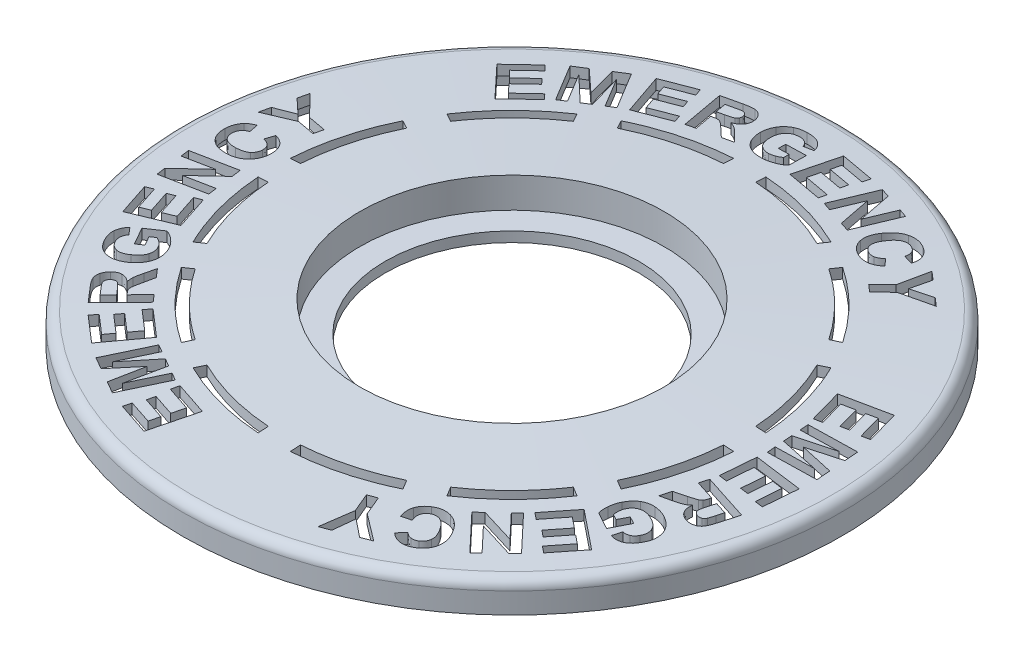
from build123d import *

# Parameters (mm, degrees)
SKETCH1_R           = 32.5
SKETCH1_R_2         = 12.5
BOSS_EXTRUDE1_DEPTH = 4
SKETCH2_R           = 15
CUT_EXTRUDE1_DEPTH  = 3
FILLET1_R           = 1
CUT_EXTRUDE5_DEPTH  = 4


# Read off the part's stored shape, not the designer's step: Shell2
with BuildPart() as part:
    # Sketch1 → Boss-Extrude1 (new body)
    with BuildSketch(Plane(origin=(0, 0, 0), x_dir=(1, 0, 0), z_dir=(0, 1, 0))):
        with Locations(Location((0, 0, 0), (0, 0, 270))):
            Circle(SKETCH1_R)
        with Locations(Location((0, 0, 0), (0, 0, 270))):
            Circle(SKETCH1_R_2, mode=Mode.SUBTRACT)
    extrude(amount=BOSS_EXTRUDE1_DEPTH)

    # Sketch2 → Cut-Extrude1 (cut)
    with BuildSketch(Plane(origin=(0, 4, 0), x_dir=(1, 0, 0), z_dir=(0, 1, 0))):
        with Locations(Location((0, 0, 0), (0, 0, 270))):
            Circle(SKETCH2_R)
    extrude(amount=-CUT_EXTRUDE1_DEPTH, mode=Mode.SUBTRACT)

    # Sketch4 → Cut-Revolve1 (revolve, cut)
    with BuildSketch(Plane.XY, mode=Mode.PRIVATE) as cut_revolve1_sk:
        Polygon((-15, 4), (-32.5, 3), (-34.981783944, 3), (-34.981783944, 6.837643027), (-15, 6.837643027), align=None)
    revolve(cut_revolve1_sk.sketch.rotate(Axis((0, 4, 0), (0, -1, 0)), 270), axis=Axis((0, 4, 0), (0, -1, 0)), mode=Mode.SUBTRACT)

    # Fillet1
    fillet1_edges = [part.edges().sort_by_distance(p)[0] for p in [
        (0, 3, -32.5),
    ]]
    fillet(fillet1_edges, radius=FILLET1_R)

    # Shell2 outline → Shell2 (revolve, cut)
    with BuildSketch(Plane.XY):
        Polygon((31.5, 0), (31.5, 2.055511535), (16, 2.94122582), (16, 0), align=None)
    revolve(axis=Axis((0, 0, 0), (0, 1, 0)), mode=Mode.SUBTRACT)

    # Sketch6 → Cut-Extrude5 (cut)
    # profile 1 of 39: a face of its own
    with BuildSketch(Plane(origin=(0, 0, 0), x_dir=(1, 0, 0), z_dir=(0, 1, 0))):
        with BuildLine():
            Line((-19.5123, 13.0985), (-18.6438, 12.5971))
            add(Edge.make_bspline(
                [(-18.6438, 12.5971), (-17.0322, 14.977), (-14.9772, 17.0323), (-12.5969, 18.6435)],
                knots=[0.4, 0.4, 0.4, 0.4, 0.6, 0.6, 0.6, 0.6], degree=3))
            Line((-12.5969, 18.6435), (-13.0981, 19.5115))
            add(Edge.make_bspline(
                [(-13.0981, 19.5115), (-15.6288, 17.8098), (-17.81, 15.6286), (-19.5123, 13.0985)],
                knots=[0, 0, 0, 0, 0.2, 0.2, 0.2, 0.2], degree=3))
        make_face()
    # profile 2 of 39: a face of its own
    with BuildSketch(Plane(origin=(0, 0, 0), x_dir=(1, 0, 0), z_dir=(0, 1, 0))):
        with BuildLine():
            Line((-23.4471, 1.5875), (-22.4447, 1.5875))
            add(Edge.make_bspline(
                [(-22.4447, 1.5875), (-22.2393, 4.5341), (-21.4664, 7.3242), (-20.2345, 9.8493)],
                knots=[0.4, 0.4, 0.4, 0.4, 0.6, 0.6, 0.6, 0.6], degree=3))
            Line((-20.2345, 9.8493), (-21.1026, 10.3504))
            add(Edge.make_bspline(
                [(-21.1026, 10.3504), (-22.4171, 7.6763), (-23.2383, 4.7158), (-23.4471, 1.5875)],
                knots=[0, 0, 0, 0, 0.2, 0.2, 0.2, 0.2], degree=3))
        make_face()
    # profile 3 of 39: a face of its own
    with BuildSketch(Plane(origin=(0, 0, 0), x_dir=(1, 0, 0), z_dir=(0, 1, 0))):
        with BuildLine():
            Line((1.5875, 23.4455), (1.5875, 22.4435))
            add(Edge.make_bspline(
                [(1.5875, 22.4435), (4.5339, 22.2381), (7.3237, 21.465), (9.8487, 20.2334)],
                knots=[0.4, 0.4, 0.4, 0.4, 0.6, 0.6, 0.6, 0.6], degree=3))
            Line((9.8487, 20.2334), (10.3498, 21.1015))
            add(Edge.make_bspline(
                [(10.3498, 21.1015), (7.6758, 22.4158), (4.7155, 23.2368), (1.5875, 23.4455)],
                knots=[0, 0, 0, 0, 0.2, 0.2, 0.2, 0.2], degree=3))
        make_face()
    # profile 4 of 39: a face of its own
    with BuildSketch(Plane(origin=(0, 0, 0), x_dir=(1, 0, 0), z_dir=(0, 1, 0))):
        with BuildLine():
            Line((13.0979, 19.5112), (12.5969, 18.6434))
            add(Edge.make_bspline(
                [(12.5969, 18.6434), (14.9769, 17.032), (17.0322, 14.9771), (18.6436, 12.597)],
                knots=[0.4, 0.4, 0.4, 0.4, 0.6, 0.6, 0.6, 0.6], degree=3))
            Line((18.6436, 12.597), (19.5115, 13.0981))
            add(Edge.make_bspline(
                [(19.5115, 13.0981), (17.8096, 15.6284), (15.6281, 17.8092), (13.0979, 19.5112)],
                knots=[0, 0, 0, 0, 0.2, 0.2, 0.2, 0.2], degree=3))
        make_face()
    # profile 5 of 39: a face of its own
    with BuildSketch(Plane(origin=(0, 0, 0), x_dir=(1, 0, 0), z_dir=(0, 1, 0))):
        with BuildLine():
            Line((21.1018, 10.35), (20.2341, 9.849))
            add(Edge.make_bspline(
                [(20.2341, 9.849), (21.4656, 7.3238), (22.2387, 4.534), (22.4441, 1.5875)],
                knots=[0.4, 0.4, 0.4, 0.4, 0.6, 0.6, 0.6, 0.6], degree=3))
            Line((22.4441, 1.5875), (23.4459, 1.5875))
            add(Edge.make_bspline(
                [(23.4459, 1.5875), (23.2372, 4.7156), (22.416, 7.6758), (21.1018, 10.35)],
                knots=[0, 0, 0, 0, 0.2, 0.2, 0.2, 0.2], degree=3))
        make_face()
    # profile 6 of 39: a face of its own
    with BuildSketch(Plane(origin=(0, 0, 0), x_dir=(1, 0, 0), z_dir=(0, 1, 0))):
        with BuildLine():
            Line((23.4471, -1.5875), (22.4447, -1.5875))
            add(Edge.make_bspline(
                [(22.4447, -1.5875), (22.2393, -4.5341), (21.4664, -7.3242), (20.2345, -9.8493)],
                knots=[0.4, 0.4, 0.4, 0.4, 0.6, 0.6, 0.6, 0.6], degree=3))
            Line((20.2345, -9.8493), (21.1026, -10.3504))
            add(Edge.make_bspline(
                [(21.1026, -10.3504), (22.4171, -7.6763), (23.2383, -4.7158), (23.4471, -1.5875)],
                knots=[0, 0, 0, 0, 0.2, 0.2, 0.2, 0.2], degree=3))
        make_face()
    # profile 7 of 39: a face of its own
    with BuildSketch(Plane(origin=(0, 0, 0), x_dir=(1, 0, 0), z_dir=(0, 1, 0))):
        with BuildLine():
            Line((19.5123, -13.0985), (18.6438, -12.5971))
            add(Edge.make_bspline(
                [(18.6438, -12.5971), (17.0322, -14.977), (14.9772, -17.0323), (12.5969, -18.6435)],
                knots=[0.4, 0.4, 0.4, 0.4, 0.6, 0.6, 0.6, 0.6], degree=3))
            Line((12.5969, -18.6435), (13.0981, -19.5115))
            add(Edge.make_bspline(
                [(13.0981, -19.5115), (15.6288, -17.8098), (17.81, -15.6286), (19.5123, -13.0985)],
                knots=[0, 0, 0, 0, 0.2, 0.2, 0.2, 0.2], degree=3))
        make_face()
    # profile 8 of 39: a face of its own
    with BuildSketch(Plane(origin=(0, 0, 0), x_dir=(1, 0, 0), z_dir=(0, 1, 0))):
        with BuildLine():
            Line((10.3495, -21.1009), (9.8488, -20.2336))
            add(Edge.make_bspline(
                [(9.8488, -20.2336), (7.3236, -21.4649), (4.5338, -22.2381), (1.5875, -22.4435)],
                knots=[0.4, 0.4, 0.4, 0.4, 0.6, 0.6, 0.6, 0.6], degree=3))
            Line((1.5875, -22.4435), (1.5875, -23.4455))
            add(Edge.make_bspline(
                [(1.5875, -23.4455), (4.7155, -23.2368), (7.6753, -22.4148), (10.3495, -21.1009)],
                knots=[0, 0, 0, 0, 0.2, 0.2, 0.2, 0.2], degree=3))
        make_face()
    # profile 9 of 39: a face of its own
    with BuildSketch(Plane(origin=(0, 0, 0), x_dir=(1, 0, 0), z_dir=(0, 1, 0))):
        with BuildLine():
            Line((-1.5875, -23.4471), (-1.5875, -22.4447))
            add(Edge.make_bspline(
                [(-1.5875, -22.4447), (-4.5341, -22.2393), (-7.3242, -21.4664), (-9.8493, -20.2345)],
                knots=[0.4, 0.4, 0.4, 0.4, 0.6, 0.6, 0.6, 0.6], degree=3))
            Line((-9.8493, -20.2345), (-10.3504, -21.1026))
            add(Edge.make_bspline(
                [(-10.3504, -21.1026), (-7.6763, -22.4171), (-4.7158, -23.2383), (-1.5875, -23.4471)],
                knots=[0, 0, 0, 0, 0.2, 0.2, 0.2, 0.2], degree=3))
        make_face()
    # profile 10 of 39: a face of its own
    with BuildSketch(Plane(origin=(0, 0, 0), x_dir=(1, 0, 0), z_dir=(0, 1, 0))):
        with BuildLine():
            Line((-13.0985, -19.5123), (-12.5971, -18.6438))
            add(Edge.make_bspline(
                [(-12.5971, -18.6438), (-14.977, -17.0322), (-17.0323, -14.9772), (-18.6435, -12.5969)],
                knots=[0.4, 0.4, 0.4, 0.4, 0.6, 0.6, 0.6, 0.6], degree=3))
            Line((-18.6435, -12.5969), (-19.5115, -13.0981))
            add(Edge.make_bspline(
                [(-19.5115, -13.0981), (-17.8098, -15.6288), (-15.6286, -17.81), (-13.0985, -19.5123)],
                knots=[0, 0, 0, 0, 0.2, 0.2, 0.2, 0.2], degree=3))
        make_face()
    # profile 11 of 39: a face of its own
    with BuildSketch(Plane(origin=(0, 0, 0), x_dir=(1, 0, 0), z_dir=(0, 1, 0))):
        with BuildLine():
            Line((-21.1009, -10.3495), (-20.2336, -9.8488))
            add(Edge.make_bspline(
                [(-20.2336, -9.8488), (-21.4649, -7.3236), (-22.2381, -4.5338), (-22.4435, -1.5875)],
                knots=[0.4, 0.4, 0.4, 0.4, 0.6, 0.6, 0.6, 0.6], degree=3))
            Line((-22.4435, -1.5875), (-23.4455, -1.5875))
            add(Edge.make_bspline(
                [(-23.4455, -1.5875), (-23.2368, -4.7155), (-22.4148, -7.6753), (-21.1009, -10.3495)],
                knots=[0, 0, 0, 0, 0.2, 0.2, 0.2, 0.2], degree=3))
        make_face()
    # profile 12 of 39: a face of its own
    with BuildSketch(Plane(origin=(0, 0, 0), x_dir=(1, 0, 0), z_dir=(0, 1, 0))):
        with BuildLine():
            add(Edge.make_bspline(
                [(-25.87, 1.7114), (-26.0189, 1.8914), (-26.2581, 2.0255), (-26.5875, 2.1138)],
                knots=[0.894736842, 0.894736842, 0.894736842, 0.894736842, 1, 1, 1, 1], degree=3))
            Line((-26.5875, 2.1138), (-26.2759, 2.9931))
            add(Edge.make_bspline(
                [(-26.2759, 2.9931), (-25.7849, 2.84), (-25.4249, 2.6), (-25.1946, 2.2755)],
                knots=[0.052631579, 0.052631579, 0.052631579, 0.052631579, 0.105263158, 0.105263158, 0.105263158, 0.105263158], degree=3))
            add(Edge.make_bspline(
                [(-25.1946, 2.2755), (-24.9653, 1.9509), (-24.8585, 1.5447), (-24.8749, 1.057)],
                knots=[0.105263158, 0.105263158, 0.105263158, 0.105263158, 0.157894737, 0.157894737, 0.157894737, 0.157894737], degree=3))
            add(Edge.make_bspline(
                [(-24.8749, 1.057), (-24.8955, 0.4538), (-25.1184, -0.0344), (-25.5436, -0.4079)],
                knots=[0.157894737, 0.157894737, 0.157894737, 0.157894737, 0.210526316, 0.210526316, 0.210526316, 0.210526316], degree=3))
            add(Edge.make_bspline(
                [(-25.5436, -0.4079), (-25.9688, -0.7824), (-26.5385, -0.9579), (-27.2527, -0.9333)],
                knots=[0.210526316, 0.210526316, 0.210526316, 0.210526316, 0.263157895, 0.263157895, 0.263157895, 0.263157895], degree=3))
            add(Edge.make_bspline(
                [(-27.2527, -0.9333), (-28.0082, -0.9073), (-28.5886, -0.6921), (-28.993, -0.2879)],
                knots=[0.263157895, 0.263157895, 0.263157895, 0.263157895, 0.315789474, 0.315789474, 0.315789474, 0.315789474], degree=3))
            add(Edge.make_bspline(
                [(-28.993, -0.2879), (-29.3983, 0.1164), (-29.59, 0.6365), (-29.5681, 1.2725)],
                knots=[0.315789474, 0.315789474, 0.315789474, 0.315789474, 0.368421053, 0.368421053, 0.368421053, 0.368421053], degree=3))
            add(Edge.make_bspline(
                [(-29.5681, 1.2725), (-29.549, 1.8279), (-29.3698, 2.2732), (-29.0296, 2.6092)],
                knots=[0.368421053, 0.368421053, 0.368421053, 0.368421053, 0.421052632, 0.421052632, 0.421052632, 0.421052632], degree=3))
            add(Edge.make_bspline(
                [(-29.0296, 2.6092), (-28.828, 2.8087), (-28.5443, 2.9535), (-28.1774, 3.0449)],
                knots=[0.421052632, 0.421052632, 0.421052632, 0.421052632, 0.473684211, 0.473684211, 0.473684211, 0.473684211], degree=3))
            Line((-28.1774, 3.0449), (-27.9919, 2.1301))
            add(Edge.make_bspline(
                [(-27.9919, 2.1301), (-28.2293, 2.0843), (-28.4185, 1.9789), (-28.5606, 1.8128)],
                knots=[0.526315789, 0.526315789, 0.526315789, 0.526315789, 0.578947368, 0.578947368, 0.578947368, 0.578947368], degree=3))
            add(Edge.make_bspline(
                [(-28.5606, 1.8128), (-28.7027, 1.6477), (-28.7773, 1.443), (-28.7866, 1.1997)],
                knots=[0.578947368, 0.578947368, 0.578947368, 0.578947368, 0.631578947, 0.631578947, 0.631578947, 0.631578947], degree=3))
            add(Edge.make_bspline(
                [(-28.7866, 1.1997), (-28.7977, 0.8621), (-28.6855, 0.585), (-28.4512, 0.3673)],
                knots=[0.631578947, 0.631578947, 0.631578947, 0.631578947, 0.684210526, 0.684210526, 0.684210526, 0.684210526], degree=3))
            add(Edge.make_bspline(
                [(-28.4512, 0.3673), (-28.2169, 0.1496), (-27.8294, 0.0322), (-27.2887, 0.0132)],
                knots=[0.684210526, 0.684210526, 0.684210526, 0.684210526, 0.736842105, 0.736842105, 0.736842105, 0.736842105], degree=3))
            add(Edge.make_bspline(
                [(-27.2887, 0.0132), (-26.7142, -0.0061), (-26.3028, 0.0838), (-26.0515, 0.2818)],
                knots=[0.736842105, 0.736842105, 0.736842105, 0.736842105, 0.789473684, 0.789473684, 0.789473684, 0.789473684], degree=3))
            add(Edge.make_bspline(
                [(-26.0515, 0.2818), (-25.8013, 0.48), (-25.6701, 0.7435), (-25.659, 1.0747)],
                knots=[0.789473684, 0.789473684, 0.789473684, 0.789473684, 0.842105263, 0.842105263, 0.842105263, 0.842105263], degree=3))
            add(Edge.make_bspline(
                [(-25.659, 1.0747), (-25.6507, 1.318), (-25.7211, 1.5303), (-25.87, 1.7114)],
                knots=[0.842105263, 0.842105263, 0.842105263, 0.842105263, 0.894736842, 0.894736842, 0.894736842, 0.894736842], degree=3))
        make_face()
    # profile 13 of 39: a face of its own
    with BuildSketch(Plane(origin=(0, 0, 0), x_dir=(1, 0, 0), z_dir=(0, 1, 0))):
        Polygon((-24.2764, -6.1642), (-23.1924, -9.4445), (-27.5043, -10.8702), (-28.5613, -7.6726), (-27.8319, -7.431), (-27.0633, -9.7581), (-26.1071, -9.4415), (-26.8225, -7.2766), (-26.0962, -7.037), (-25.3808, -9.2021), (-24.2071, -8.8136), (-25.0038, -6.4047), align=None)
    # profile 14 of 39: a face of its own
    with BuildSketch(Plane(origin=(0, 0, 0), x_dir=(1, 0, 0), z_dir=(0, 1, 0))):
        with BuildLine():
            add(Edge.make_bspline(
                [(-22.922, -11.9042), (-23.0838, -11.7738), (-23.2455, -11.6751), (-23.4073, -11.6081)],
                knots=[0.84, 0.84, 0.84, 0.84, 0.88, 0.88, 0.88, 0.88], degree=3))
            Line((-23.4073, -11.6081), (-23.9074, -11.893))
            Line((-23.9074, -11.893), (-23.3872, -12.8052))
            Line((-23.3872, -12.8052), (-24.0515, -13.1849))
            Line((-24.0515, -13.1849), (-25.0316, -11.4676))
            Line((-25.0316, -11.4676), (-23.4594, -10.5719))
            add(Edge.make_bspline(
                [(-23.4594, -10.5719), (-23.2034, -10.6465), (-22.9233, -10.8068), (-22.6189, -11.0529)],
                knots=[0.12, 0.12, 0.12, 0.12, 0.16, 0.16, 0.16, 0.16], degree=3))
            add(Edge.make_bspline(
                [(-22.6189, -11.0529), (-22.3156, -11.3001), (-22.0716, -11.5851), (-21.886, -11.9105)],
                knots=[0.16, 0.16, 0.16, 0.16, 0.2, 0.2, 0.2, 0.2], degree=3))
            add(Edge.make_bspline(
                [(-21.886, -11.9105), (-21.6507, -12.3225), (-21.5329, -12.7324), (-21.5305, -13.1377)],
                knots=[0.2, 0.2, 0.2, 0.2, 0.24, 0.24, 0.24, 0.24], degree=3))
            add(Edge.make_bspline(
                [(-21.5305, -13.1377), (-21.529, -13.543), (-21.6451, -13.9143), (-21.8785, -14.2525)],
                knots=[0.24, 0.24, 0.24, 0.24, 0.28, 0.28, 0.28, 0.28], degree=3))
            add(Edge.make_bspline(
                [(-21.8785, -14.2525), (-22.1131, -14.5907), (-22.4194, -14.8674), (-22.7976, -15.0837)],
                knots=[0.28, 0.28, 0.28, 0.28, 0.32, 0.32, 0.32, 0.32], degree=3))
            add(Edge.make_bspline(
                [(-22.7976, -15.0837), (-23.2087, -15.318), (-23.6227, -15.44), (-24.0408, -15.4498)],
                knots=[0.32, 0.32, 0.32, 0.32, 0.36, 0.36, 0.36, 0.36], degree=3))
            add(Edge.make_bspline(
                [(-24.0408, -15.4498), (-24.4578, -15.4596), (-24.846, -15.3468), (-25.2065, -15.1122)],
                knots=[0.36, 0.36, 0.36, 0.36, 0.4, 0.4, 0.4, 0.4], degree=3))
            add(Edge.make_bspline(
                [(-25.2065, -15.1122), (-25.4813, -14.9339), (-25.7263, -14.6572), (-25.9415, -14.2801)],
                knots=[0.4, 0.4, 0.4, 0.4, 0.44, 0.44, 0.44, 0.44], degree=3))
            add(Edge.make_bspline(
                [(-25.9415, -14.2801), (-26.2211, -13.7906), (-26.3357, -13.3491), (-26.2873, -12.9565)],
                knots=[0.44, 0.44, 0.44, 0.44, 0.48, 0.48, 0.48, 0.48], degree=3))
            add(Edge.make_bspline(
                [(-26.2873, -12.9565), (-26.239, -12.564), (-26.0563, -12.2246), (-25.7394, -11.9394)],
                knots=[0.48, 0.48, 0.48, 0.48, 0.52, 0.52, 0.52, 0.52], degree=3))
            Line((-25.7394, -11.9394), (-25.1396, -12.6464))
            add(Edge.make_bspline(
                [(-25.1396, -12.6464), (-25.3018, -12.8123), (-25.3952, -13.0037), (-25.42, -13.2216)],
                knots=[0.56, 0.56, 0.56, 0.56, 0.6, 0.6, 0.6, 0.6], degree=3))
            add(Edge.make_bspline(
                [(-25.42, -13.2216), (-25.4447, -13.4385), (-25.3912, -13.6619), (-25.2603, -13.8918)],
                knots=[0.6, 0.6, 0.6, 0.6, 0.64, 0.64, 0.64, 0.64], degree=3))
            add(Edge.make_bspline(
                [(-25.2603, -13.8918), (-25.062, -14.2393), (-24.7936, -14.4536), (-24.4561, -14.5336)],
                knots=[0.64, 0.64, 0.64, 0.64, 0.68, 0.68, 0.68, 0.68], degree=3))
            add(Edge.make_bspline(
                [(-24.4561, -14.5336), (-24.1186, -14.6126), (-23.7322, -14.5286), (-23.2978, -14.2807)],
                knots=[0.68, 0.68, 0.68, 0.68, 0.72, 0.72, 0.72, 0.72], degree=3))
            add(Edge.make_bspline(
                [(-23.2978, -14.2807), (-22.8296, -14.0138), (-22.538, -13.7094), (-22.423, -13.3678)],
                knots=[0.72, 0.72, 0.72, 0.72, 0.76, 0.76, 0.76, 0.76], degree=3))
            add(Edge.make_bspline(
                [(-22.423, -13.3678), (-22.3071, -13.0262), (-22.3456, -12.6875), (-22.5376, -12.3495)],
                knots=[0.76, 0.76, 0.76, 0.76, 0.8, 0.8, 0.8, 0.8], degree=3))
            add(Edge.make_bspline(
                [(-22.5376, -12.3495), (-22.6336, -12.1831), (-22.7614, -12.0347), (-22.922, -11.9042)],
                knots=[0.8, 0.8, 0.8, 0.8, 0.84, 0.84, 0.84, 0.84], degree=3))
        make_face()
    # profile 15 of 39: a face of its own
    with BuildSketch(Plane(origin=(0, 0, 0), x_dir=(1, 0, 0), z_dir=(0, 1, 0))):
        with BuildLine():
            add(Edge.make_bspline(
                [(-20.4281, -17.4009), (-20.3901, -17.4962), (-20.3025, -17.6243), (-20.1652, -17.7834)],
                knots=[0.736842105, 0.736842105, 0.736842105, 0.736842105, 0.789473684, 0.789473684, 0.789473684, 0.789473684], degree=3))
            Line((-20.1652, -17.7834), (-20.0438, -17.9244))
            Line((-20.0438, -17.9244), (-18.6097, -16.6854))
            Line((-18.6097, -16.6854), (-18.0098, -17.3796))
            Line((-18.0098, -17.3796), (-21.447, -20.3466))
            Line((-21.447, -20.3466), (-22.7082, -18.886))
            add(Edge.make_bspline(
                [(-22.7082, -18.886), (-23.0251, -18.5182), (-23.2245, -18.2248), (-23.3067, -18.0056)],
                knots=[0.105263158, 0.105263158, 0.105263158, 0.105263158, 0.157894737, 0.157894737, 0.157894737, 0.157894737], degree=3))
            add(Edge.make_bspline(
                [(-23.3067, -18.0056), (-23.3878, -17.7853), (-23.3938, -17.5577), (-23.3224, -17.3218)],
                knots=[0.157894737, 0.157894737, 0.157894737, 0.157894737, 0.210526316, 0.210526316, 0.210526316, 0.210526316], degree=3))
            add(Edge.make_bspline(
                [(-23.3224, -17.3218), (-23.2501, -17.0849), (-23.1133, -16.8788), (-22.9097, -16.7034)],
                knots=[0.210526316, 0.210526316, 0.210526316, 0.210526316, 0.263157895, 0.263157895, 0.263157895, 0.263157895], degree=3))
            add(Edge.make_bspline(
                [(-22.9097, -16.7034), (-22.6521, -16.4816), (-22.3737, -16.3731), (-22.0752, -16.3799)],
                knots=[0.263157895, 0.263157895, 0.263157895, 0.263157895, 0.315789474, 0.315789474, 0.315789474, 0.315789474], degree=3))
            add(Edge.make_bspline(
                [(-22.0752, -16.3799), (-21.7757, -16.3868), (-21.4743, -16.5216), (-21.17, -16.7858)],
                knots=[0.315789474, 0.315789474, 0.315789474, 0.315789474, 0.368421053, 0.368421053, 0.368421053, 0.368421053], degree=3))
            add(Edge.make_bspline(
                [(-21.17, -16.7858), (-21.2119, -16.5602), (-21.2232, -16.3528), (-21.2028, -16.1645)],
                knots=[0.368421053, 0.368421053, 0.368421053, 0.368421053, 0.421052632, 0.421052632, 0.421052632, 0.421052632], degree=3))
            add(Edge.make_bspline(
                [(-21.2028, -16.1645), (-21.1823, -15.9771), (-21.1099, -15.6852), (-20.9853, -15.2885)],
                knots=[0.421052632, 0.421052632, 0.421052632, 0.421052632, 0.473684211, 0.473684211, 0.473684211, 0.473684211], degree=3))
            Line((-20.9853, -15.2885), (-20.6778, -14.29))
            Line((-20.6778, -14.29), (-19.9606, -15.1199))
            Line((-19.9606, -15.1199), (-20.2759, -16.2666))
            add(Edge.make_bspline(
                [(-20.2759, -16.2666), (-20.3898, -16.6759), (-20.4526, -16.9436), (-20.4656, -17.0685)],
                knots=[0.631578947, 0.631578947, 0.631578947, 0.631578947, 0.684210526, 0.684210526, 0.684210526, 0.684210526], degree=3))
            add(Edge.make_bspline(
                [(-20.4656, -17.0685), (-20.4785, -17.1944), (-20.466, -17.3056), (-20.4281, -17.4009)],
                knots=[0.684210526, 0.684210526, 0.684210526, 0.684210526, 0.736842105, 0.736842105, 0.736842105, 0.736842105], degree=3))
        make_face()
        with BuildLine():
            add(Edge.make_bspline(
                [(-22.3576, -18.0929), (-22.3164, -18.1554), (-22.1749, -18.3281), (-21.9319, -18.609)],
                knots=[0.6, 0.6, 0.6, 0.6, 0.7, 0.7, 0.7, 0.7], degree=3))
            Line((-21.9319, -18.609), (-21.4651, -19.1506))
            Line((-21.4651, -19.1506), (-20.5928, -18.3976))
            Line((-20.5928, -18.3976), (-21.0354, -17.8845))
            add(Edge.make_bspline(
                [(-21.0354, -17.8845), (-21.3226, -17.5517), (-21.517, -17.3556), (-21.6164, -17.2972)],
                knots=[0.1, 0.1, 0.1, 0.1, 0.2, 0.2, 0.2, 0.2], degree=3))
            add(Edge.make_bspline(
                [(-21.6164, -17.2972), (-21.7158, -17.2389), (-21.8205, -17.2154), (-21.9296, -17.2279)],
                knots=[0.2, 0.2, 0.2, 0.2, 0.3, 0.3, 0.3, 0.3], degree=3))
            add(Edge.make_bspline(
                [(-21.9296, -17.2279), (-22.0386, -17.2404), (-22.1445, -17.291), (-22.2484, -17.3808)],
                knots=[0.3, 0.3, 0.3, 0.3, 0.4, 0.4, 0.4, 0.4], degree=3))
            add(Edge.make_bspline(
                [(-22.2484, -17.3808), (-22.3639, -17.48), (-22.4308, -17.5922), (-22.4479, -17.7149)],
                knots=[0.4, 0.4, 0.4, 0.4, 0.5, 0.5, 0.5, 0.5], degree=3))
            add(Edge.make_bspline(
                [(-22.4479, -17.7149), (-22.4661, -17.8377), (-22.4356, -17.9637), (-22.3576, -18.0929)],
                knots=[0.5, 0.5, 0.5, 0.5, 0.6, 0.6, 0.6, 0.6], degree=3))
        make_face(mode=Mode.SUBTRACT)
    # profile 16 of 39: a face of its own
    with BuildSketch(Plane(origin=(0, 0, 0), x_dir=(1, 0, 0), z_dir=(0, 1, 0))):
        Polygon((-17.4586, -17.9431), (-14.8481, -20.2045), (-17.8214, -23.6365), (-20.3663, -21.4322), (-19.8636, -20.8513), (-18.0118, -22.4557), (-17.3527, -21.6947), (-19.0762, -20.2023), (-18.5745, -19.6235), (-16.851, -21.116), (-16.0419, -20.1822), (-17.9594, -18.5208), align=None)
    # profile 17 of 39: a face of its own
    with BuildSketch(Plane(origin=(0, 0, 0), x_dir=(1, 0, 0), z_dir=(0, 1, 0))):
        Polygon((-11.0264, -22.4969), (-10.2869, -22.9199), (-12.5436, -26.8611), (-13.7343, -26.1796), (-12.9102, -23.0813), (-15.1561, -25.365), (-16.3489, -24.6814), (-14.0923, -20.7414), (-13.3539, -21.1644), (-15.1295, -24.2665), (-12.571, -21.6118), (-11.805, -22.0506), (-12.802, -25.5989), align=None)
    # profile 18 of 39: a face of its own
    with BuildSketch(Plane(origin=(0, 0, 0), x_dir=(1, 0, 0), z_dir=(0, 1, 0))):
        Polygon((8.9577, -23.3163), (9.8114, -22.988), (10.4969, -24.7729), (12.9949, -26.6323), (11.9904, -27.0187), (10.3482, -25.7231), (10.0144, -27.7778), (9.028, -28.1569), (9.6412, -25.0949), align=None)
    # profile 19 of 39: a face of its own
    with BuildSketch(Plane(origin=(0, 0, 0), x_dir=(1, 0, 0), z_dir=(0, 1, 0))):
        with BuildLine():
            add(Edge.make_bspline(
                [(13.2083, -22.3148), (13.1424, -22.5399), (13.1652, -22.8131), (13.2787, -23.1344)],
                knots=[0.894736842, 0.894736842, 0.894736842, 0.894736842, 1, 1, 1, 1], degree=3))
            Line((13.2787, -23.1344), (12.3756, -23.3715))
            add(Edge.make_bspline(
                [(12.3756, -23.3715), (12.2271, -22.8795), (12.2212, -22.4466), (12.3609, -22.0739)],
                knots=[0.052631579, 0.052631579, 0.052631579, 0.052631579, 0.105263158, 0.105263158, 0.105263158, 0.105263158], degree=3))
            add(Edge.make_bspline(
                [(12.3609, -22.0739), (12.5007, -21.7011), (12.7767, -21.3841), (13.1889, -21.1241)],
                knots=[0.105263158, 0.105263158, 0.105263158, 0.105263158, 0.157894737, 0.157894737, 0.157894737, 0.157894737], degree=3))
            add(Edge.make_bspline(
                [(13.1889, -21.1241), (13.6998, -20.8021), (14.2284, -20.7121), (14.7769, -20.8529)],
                knots=[0.157894737, 0.157894737, 0.157894737, 0.157894737, 0.210526316, 0.210526316, 0.210526316, 0.210526316], degree=3))
            add(Edge.make_bspline(
                [(14.7769, -20.8529), (15.3254, -20.9936), (15.791, -21.3668), (16.1727, -21.9712)],
                knots=[0.210526316, 0.210526316, 0.210526316, 0.210526316, 0.263157895, 0.263157895, 0.263157895, 0.263157895], degree=3))
            add(Edge.make_bspline(
                [(16.1727, -21.9712), (16.5764, -22.6108), (16.7242, -23.2116), (16.6173, -23.7741)],
                knots=[0.263157895, 0.263157895, 0.263157895, 0.263157895, 0.315789474, 0.315789474, 0.315789474, 0.315789474], degree=3))
            add(Edge.make_bspline(
                [(16.6173, -23.7741), (16.5102, -24.3355), (16.188, -24.7865), (15.6505, -25.1263)],
                knots=[0.315789474, 0.315789474, 0.315789474, 0.315789474, 0.368421053, 0.368421053, 0.368421053, 0.368421053], degree=3))
            add(Edge.make_bspline(
                [(15.6505, -25.1263), (15.1799, -25.4231), (14.7105, -25.5251), (14.2422, -25.4324)],
                knots=[0.368421053, 0.368421053, 0.368421053, 0.368421053, 0.421052632, 0.421052632, 0.421052632, 0.421052632], degree=3))
            add(Edge.make_bspline(
                [(14.2422, -25.4324), (13.9641, -25.3789), (13.6834, -25.2259), (13.4024, -24.9735)],
                knots=[0.421052632, 0.421052632, 0.421052632, 0.421052632, 0.473684211, 0.473684211, 0.473684211, 0.473684211], degree=3))
            Line((13.4024, -24.9735), (14.054, -24.3052))
            add(Edge.make_bspline(
                [(14.054, -24.3052), (14.2255, -24.4756), (14.4197, -24.573), (14.6364, -24.5976)],
                knots=[0.526315789, 0.526315789, 0.526315789, 0.526315789, 0.578947368, 0.578947368, 0.578947368, 0.578947368], degree=3))
            add(Edge.make_bspline(
                [(14.6364, -24.5976), (14.8533, -24.6221), (15.0652, -24.5694), (15.2714, -24.4394)],
                knots=[0.578947368, 0.578947368, 0.578947368, 0.578947368, 0.631578947, 0.631578947, 0.631578947, 0.631578947], degree=3))
            add(Edge.make_bspline(
                [(15.2714, -24.4394), (15.556, -24.259), (15.7226, -24.0112), (15.77, -23.695)],
                knots=[0.631578947, 0.631578947, 0.631578947, 0.631578947, 0.684210526, 0.684210526, 0.684210526, 0.684210526], degree=3))
            add(Edge.make_bspline(
                [(15.77, -23.695), (15.8183, -23.3778), (15.6979, -22.9908), (15.4095, -22.5341)],
                knots=[0.684210526, 0.684210526, 0.684210526, 0.684210526, 0.736842105, 0.736842105, 0.736842105, 0.736842105], degree=3))
            add(Edge.make_bspline(
                [(15.4095, -22.5341), (15.1033, -22.0476), (14.797, -21.7568), (14.4928, -21.6608)],
                knots=[0.736842105, 0.736842105, 0.736842105, 0.736842105, 0.789473684, 0.789473684, 0.789473684, 0.789473684], degree=3))
            add(Edge.make_bspline(
                [(14.4928, -21.6608), (14.1875, -21.5659), (13.8951, -21.6056), (13.6158, -21.7828)],
                knots=[0.789473684, 0.789473684, 0.789473684, 0.789473684, 0.842105263, 0.842105263, 0.842105263, 0.842105263], degree=3))
            add(Edge.make_bspline(
                [(13.6158, -21.7828), (13.4096, -21.9128), (13.2732, -22.0897), (13.2083, -22.3148)],
                knots=[0.842105263, 0.842105263, 0.842105263, 0.842105263, 0.894736842, 0.894736842, 0.894736842, 0.894736842], degree=3))
        make_face()
    # profile 20 of 39: a face of its own
    with BuildSketch(Plane(origin=(0, 0, 0), x_dir=(1, 0, 0), z_dir=(0, 1, 0))):
        Polygon((17.6366, -17.7043), (18.2586, -17.1199), (21.3709, -20.4315), (20.7202, -21.0422), (17.2866, -20.1056), (19.3647, -22.3161), (18.7439, -22.9006), (15.6316, -19.5889), (16.3024, -18.9583), (19.6664, -19.8627), align=None)
    # profile 21 of 39: a face of its own
    with BuildSketch(Plane(origin=(0, 0, 0), x_dir=(1, 0, 0), z_dir=(0, 1, 0))):
        Polygon((18.7838, -16.5254), (20.9272, -13.8179), (24.4879, -16.6358), (22.3986, -19.2757), (21.7957, -18.7988), (23.3167, -16.878), (22.5268, -16.2524), (21.112, -18.0401), (20.5122, -17.5653), (21.9271, -15.7776), (20.9587, -15.0108), (19.3835, -17.0001), align=None)
    # profile 22 of 39: a face of its own
    with BuildSketch(Plane(origin=(0, 0, 0), x_dir=(1, 0, 0), z_dir=(0, 1, 0))):
        with BuildLine():
            add(Edge.make_bspline(
                [(22.75, -12.1931), (22.7284, -12.3994), (22.7333, -12.5889), (22.7647, -12.7615)],
                knots=[0.84, 0.84, 0.84, 0.84, 0.88, 0.88, 0.88, 0.88], degree=3))
            Line((22.7647, -12.7615), (23.2774, -13.0259))
            Line((23.2774, -13.0259), (23.7599, -12.0924))
            Line((23.7599, -12.0924), (24.4397, -12.4432))
            Line((24.4397, -12.4432), (23.5322, -14.2002))
            Line((23.5322, -14.2002), (21.9242, -13.3692))
            add(Edge.make_bspline(
                [(21.9242, -13.3692), (21.8474, -13.1141), (21.8291, -12.7912), (21.8711, -12.4018)],
                knots=[0.12, 0.12, 0.12, 0.12, 0.16, 0.16, 0.16, 0.16], degree=3))
            add(Edge.make_bspline(
                [(21.8711, -12.4018), (21.9121, -12.0135), (22.0188, -11.6528), (22.1909, -11.3209)],
                knots=[0.16, 0.16, 0.16, 0.16, 0.2, 0.2, 0.2, 0.2], degree=3))
            add(Edge.make_bspline(
                [(22.1909, -11.3209), (22.4087, -10.898), (22.6878, -10.5758), (23.0268, -10.3532)],
                knots=[0.2, 0.2, 0.2, 0.2, 0.24, 0.24, 0.24, 0.24], degree=3))
            add(Edge.make_bspline(
                [(23.0268, -10.3532), (23.366, -10.1306), (23.7409, -10.0255), (24.1526, -10.038)],
                knots=[0.24, 0.24, 0.24, 0.24, 0.28, 0.28, 0.28, 0.28], degree=3))
            add(Edge.make_bspline(
                [(24.1526, -10.038), (24.5632, -10.0505), (24.9629, -10.1572), (25.3499, -10.357)],
                knots=[0.28, 0.28, 0.28, 0.28, 0.32, 0.32, 0.32, 0.32], degree=3))
            add(Edge.make_bspline(
                [(25.3499, -10.357), (25.7707, -10.5737), (26.0982, -10.8549), (26.3335, -11.2003)],
                knots=[0.32, 0.32, 0.32, 0.32, 0.36, 0.36, 0.36, 0.36], degree=3))
            add(Edge.make_bspline(
                [(26.3335, -11.2003), (26.5698, -11.5448), (26.6876, -11.9324), (26.6856, -12.3621)],
                knots=[0.36, 0.36, 0.36, 0.36, 0.4, 0.4, 0.4, 0.4], degree=3))
            add(Edge.make_bspline(
                [(26.6856, -12.3621), (26.686, -12.6902), (26.5868, -13.0467), (26.3881, -13.4325)],
                knots=[0.4, 0.4, 0.4, 0.4, 0.44, 0.44, 0.44, 0.44], degree=3))
            add(Edge.make_bspline(
                [(26.3881, -13.4325), (26.1288, -13.9336), (25.8212, -14.2706), (25.4663, -14.4445)],
                knots=[0.44, 0.44, 0.44, 0.44, 0.48, 0.48, 0.48, 0.48], degree=3))
            add(Edge.make_bspline(
                [(25.4663, -14.4445), (25.1103, -14.6173), (24.7261, -14.6483), (24.3136, -14.5373)],
                knots=[0.48, 0.48, 0.48, 0.48, 0.52, 0.52, 0.52, 0.52], degree=3))
            Line((24.3136, -14.5373), (24.58, -13.6499))
            add(Edge.make_bspline(
                [(24.58, -13.6499), (24.8074, -13.6959), (25.0191, -13.6689), (25.2152, -13.5719)],
                knots=[0.56, 0.56, 0.56, 0.56, 0.6, 0.6, 0.6, 0.6], degree=3))
            add(Edge.make_bspline(
                [(25.2152, -13.5719), (25.4112, -13.4739), (25.5703, -13.3081), (25.6914, -13.0723)],
                knots=[0.6, 0.6, 0.6, 0.6, 0.64, 0.64, 0.64, 0.64], degree=3))
            add(Edge.make_bspline(
                [(25.6914, -13.0723), (25.8752, -12.716), (25.9088, -12.3753), (25.7909, -12.048)],
                knots=[0.64, 0.64, 0.64, 0.64, 0.68, 0.68, 0.68, 0.68], degree=3))
            add(Edge.make_bspline(
                [(25.7909, -12.048), (25.6741, -11.7218), (25.3932, -11.4429), (24.9492, -11.2144)],
                knots=[0.68, 0.68, 0.68, 0.68, 0.72, 0.72, 0.72, 0.72], degree=3))
            add(Edge.make_bspline(
                [(24.9492, -11.2144), (24.4702, -10.9668), (24.0555, -10.8876), (23.7061, -10.9769)],
                knots=[0.72, 0.72, 0.72, 0.72, 0.76, 0.76, 0.76, 0.76], degree=3))
            add(Edge.make_bspline(
                [(23.7061, -10.9769), (23.3567, -11.0661), (23.0927, -11.2826), (22.9141, -11.6282)],
                knots=[0.76, 0.76, 0.76, 0.76, 0.8, 0.8, 0.8, 0.8], degree=3))
            add(Edge.make_bspline(
                [(22.9141, -11.6282), (22.826, -11.7984), (22.7716, -11.9867), (22.75, -12.1931)],
                knots=[0.8, 0.8, 0.8, 0.8, 0.84, 0.84, 0.84, 0.84], degree=3))
        make_face()
    # profile 23 of 39: a face of its own
    with BuildSketch(Plane(origin=(0, 0, 0), x_dir=(1, 0, 0), z_dir=(0, 1, 0))):
        with BuildLine():
            add(Edge.make_bspline(
                [(25.9056, -7.0533), (25.9647, -6.9686), (26.0235, -6.8255), (26.0802, -6.6222)],
                knots=[0.736842105, 0.736842105, 0.736842105, 0.736842105, 0.789473684, 0.789473684, 0.789473684, 0.789473684], degree=3))
            Line((26.0802, -6.6222), (26.1305, -6.4432))
            Line((26.1305, -6.4432), (24.3057, -5.9292))
            Line((24.3057, -5.9292), (24.5553, -5.0459))
            Line((24.5553, -5.0459), (28.9262, -6.2794))
            Line((28.9262, -6.2794), (28.4018, -8.1371))
            add(Edge.make_bspline(
                [(28.4018, -8.1371), (28.2707, -8.6042), (28.135, -8.9326), (27.9968, -9.1224)],
                knots=[0.105263158, 0.105263158, 0.105263158, 0.105263158, 0.157894737, 0.157894737, 0.157894737, 0.157894737], degree=3))
            add(Edge.make_bspline(
                [(27.9968, -9.1224), (27.8587, -9.3121), (27.6717, -9.4418), (27.4348, -9.5122)],
                knots=[0.157894737, 0.157894737, 0.157894737, 0.157894737, 0.210526316, 0.210526316, 0.210526316, 0.210526316], degree=3))
            add(Edge.make_bspline(
                [(27.4348, -9.5122), (27.198, -9.5826), (26.9502, -9.5822), (26.6919, -9.5088)],
                knots=[0.210526316, 0.210526316, 0.210526316, 0.210526316, 0.263157895, 0.263157895, 0.263157895, 0.263157895], degree=3))
            add(Edge.make_bspline(
                [(26.6919, -9.5088), (26.3645, -9.4165), (26.1207, -9.2435), (25.9613, -8.9899)],
                knots=[0.263157895, 0.263157895, 0.263157895, 0.263157895, 0.315789474, 0.315789474, 0.315789474, 0.315789474], degree=3))
            add(Edge.make_bspline(
                [(25.9613, -8.9899), (25.802, -8.7374), (25.7482, -8.4116), (25.8012, -8.0114)],
                knots=[0.315789474, 0.315789474, 0.315789474, 0.315789474, 0.368421053, 0.368421053, 0.368421053, 0.368421053], degree=3))
            add(Edge.make_bspline(
                [(25.8012, -8.0114), (25.6364, -8.1717), (25.4695, -8.2937), (25.3015, -8.381)],
                knots=[0.368421053, 0.368421053, 0.368421053, 0.368421053, 0.421052632, 0.421052632, 0.421052632, 0.421052632], degree=3))
            add(Edge.make_bspline(
                [(25.3015, -8.381), (25.1323, -8.4671), (24.849, -8.5684), (24.4493, -8.6827)],
                knots=[0.421052632, 0.421052632, 0.421052632, 0.421052632, 0.473684211, 0.473684211, 0.473684211, 0.473684211], degree=3))
            Line((24.4493, -8.6827), (23.4467, -8.9763))
            Line((23.4467, -8.9763), (23.7445, -7.9203))
            Line((23.7445, -7.9203), (24.875, -7.5512))
            add(Edge.make_bspline(
                [(24.875, -7.5512), (25.2789, -7.4201), (25.5369, -7.3252), (25.6489, -7.2667)],
                knots=[0.631578947, 0.631578947, 0.631578947, 0.631578947, 0.684210526, 0.684210526, 0.684210526, 0.684210526], degree=3))
            add(Edge.make_bspline(
                [(25.6489, -7.2667), (25.761, -7.2082), (25.8465, -7.1371), (25.9056, -7.0533)],
                knots=[0.684210526, 0.684210526, 0.684210526, 0.684210526, 0.736842105, 0.736842105, 0.736842105, 0.736842105], degree=3))
        make_face()
        with BuildLine():
            add(Edge.make_bspline(
                [(27.547, -8.2821), (27.5775, -8.2132), (27.6426, -8.0003), (27.7433, -7.6424)],
                knots=[0.6, 0.6, 0.6, 0.6, 0.7, 0.7, 0.7, 0.7], degree=3))
            Line((27.7433, -7.6424), (27.9384, -6.9529))
            Line((27.9384, -6.9529), (26.8285, -6.6404))
            Line((26.8285, -6.6404), (26.6439, -7.2938))
            add(Edge.make_bspline(
                [(26.6439, -7.2938), (26.5253, -7.7164), (26.4678, -7.9865), (26.4745, -8.1018)],
                knots=[0.1, 0.1, 0.1, 0.1, 0.2, 0.2, 0.2, 0.2], degree=3))
            add(Edge.make_bspline(
                [(26.4745, -8.1018), (26.4801, -8.2171), (26.5184, -8.3176), (26.5896, -8.402)],
                knots=[0.2, 0.2, 0.2, 0.2, 0.3, 0.3, 0.3, 0.3], degree=3))
            add(Edge.make_bspline(
                [(26.5896, -8.402), (26.6596, -8.4854), (26.7614, -8.5466), (26.8916, -8.5833)],
                knots=[0.3, 0.3, 0.3, 0.3, 0.4, 0.4, 0.4, 0.4], degree=3))
            add(Edge.make_bspline(
                [(26.8916, -8.5833), (27.0389, -8.6252), (27.169, -8.6197), (27.2821, -8.5665)],
                knots=[0.4, 0.4, 0.4, 0.4, 0.5, 0.5, 0.5, 0.5], degree=3))
            add(Edge.make_bspline(
                [(27.2821, -8.5665), (27.3942, -8.5133), (27.4828, -8.4188), (27.547, -8.2821)],
                knots=[0.5, 0.5, 0.5, 0.5, 0.6, 0.6, 0.6, 0.6], degree=3))
        make_face(mode=Mode.SUBTRACT)
    # profile 24 of 39: a face of its own
    with BuildSketch(Plane(origin=(0, 0, 0), x_dir=(1, 0, 0), z_dir=(0, 1, 0))):
        Polygon((24.7131, -4.2672), (24.9999, -0.8262), (29.5241, -1.2021), (29.2453, -4.5575), (28.4806, -4.4935), (28.6828, -2.0521), (27.68, -1.9687), (27.4915, -4.2408), (26.7288, -4.1769), (26.9173, -1.9057), (25.6861, -1.8029), (25.4758, -4.3312), align=None)
    # profile 25 of 39: a face of its own
    with BuildSketch(Plane(origin=(0, 0, 0), x_dir=(1, 0, 0), z_dir=(0, 1, 0))):
        Polygon((24.492, 5.2151), (23.5596, 8.5428), (27.9358, 9.7688), (28.8451, 6.5249), (28.1048, 6.3172), (27.443, 8.6779), (26.4729, 8.4063), (27.0885, 6.2097), (26.3514, 6.0031), (25.7357, 8.1996), (24.5443, 7.8661), (25.2291, 5.4217), align=None)
    # profile 26 of 39: a face of its own
    with BuildSketch(Plane(origin=(0, 0, 0), x_dir=(1, 0, 0), z_dir=(0, 1, 0))):
        with BuildLine():
            add(Edge.make_bspline(
                [(13.5876, 22.1103), (13.8172, 22.1573), (14.0477, 22.3059), (14.279, 22.5571)],
                knots=[0.894736842, 0.894736842, 0.894736842, 0.894736842, 1, 1, 1, 1], degree=3))
            Line((14.279, 22.5571), (14.911, 21.8703))
            add(Edge.make_bspline(
                [(14.911, 21.8703), (14.5465, 21.5077), (14.1669, 21.3017), (13.7722, 21.2502)],
                knots=[0.052631579, 0.052631579, 0.052631579, 0.052631579, 0.105263158, 0.105263158, 0.105263158, 0.105263158], degree=3))
            add(Edge.make_bspline(
                [(13.7722, 21.2502), (13.3776, 21.1986), (12.9689, 21.2942), (12.5451, 21.5358)],
                knots=[0.105263158, 0.105263158, 0.105263158, 0.105263158, 0.157894737, 0.157894737, 0.157894737, 0.157894737], degree=3))
            add(Edge.make_bspline(
                [(12.5451, 21.5358), (12.0228, 21.8354), (11.695, 22.2614), (11.5628, 22.8115)],
                knots=[0.157894737, 0.157894737, 0.157894737, 0.157894737, 0.210526316, 0.210526316, 0.210526316, 0.210526316], degree=3))
            add(Edge.make_bspline(
                [(11.5628, 22.8115), (11.4306, 23.3616), (11.5417, 23.947), (11.8962, 24.5668)],
                knots=[0.210526316, 0.210526316, 0.210526316, 0.210526316, 0.263157895, 0.263157895, 0.263157895, 0.263157895], degree=3))
            add(Edge.make_bspline(
                [(11.8962, 24.5668), (12.2717, 25.2226), (12.7335, 25.6351), (13.2793, 25.8044)],
                knots=[0.263157895, 0.263157895, 0.263157895, 0.263157895, 0.315789474, 0.315789474, 0.315789474, 0.315789474], degree=3))
            add(Edge.make_bspline(
                [(13.2793, 25.8044), (13.8262, 25.9726), (14.3755, 25.8994), (14.9276, 25.583)],
                knots=[0.315789474, 0.315789474, 0.315789474, 0.315789474, 0.368421053, 0.368421053, 0.368421053, 0.368421053], degree=3))
            add(Edge.make_bspline(
                [(14.9276, 25.583), (15.4095, 25.3076), (15.7192, 24.941), (15.8576, 24.484)],
                knots=[0.368421053, 0.368421053, 0.368421053, 0.368421053, 0.421052632, 0.421052632, 0.421052632, 0.421052632], degree=3))
            add(Edge.make_bspline(
                [(15.8576, 24.484), (15.9397, 24.2121), (15.936, 23.8935), (15.8446, 23.5273)],
                knots=[0.421052632, 0.421052632, 0.421052632, 0.421052632, 0.473684211, 0.473684211, 0.473684211, 0.473684211], degree=3))
            Line((15.8446, 23.5273), (14.9499, 23.7902))
            add(Edge.make_bspline(
                [(14.9499, 23.7902), (15.0203, 24.021), (15.0146, 24.238), (14.9349, 24.4411)],
                knots=[0.526315789, 0.526315789, 0.526315789, 0.526315789, 0.578947368, 0.578947368, 0.578947368, 0.578947368], degree=3))
            add(Edge.make_bspline(
                [(14.9349, 24.4411), (14.8551, 24.643), (14.7088, 24.8058), (14.498, 24.9271)],
                knots=[0.578947368, 0.578947368, 0.578947368, 0.578947368, 0.631578947, 0.631578947, 0.631578947, 0.631578947], degree=3))
            add(Edge.make_bspline(
                [(14.498, 24.9271), (14.2055, 25.0938), (13.9081, 25.125), (13.6066, 25.0197)],
                knots=[0.631578947, 0.631578947, 0.631578947, 0.631578947, 0.684210526, 0.684210526, 0.684210526, 0.684210526], degree=3))
            add(Edge.make_bspline(
                [(13.6066, 25.0197), (13.3042, 24.9133), (13.019, 24.6259), (12.7499, 24.1566)],
                knots=[0.684210526, 0.684210526, 0.684210526, 0.684210526, 0.736842105, 0.736842105, 0.736842105, 0.736842105], degree=3))
            add(Edge.make_bspline(
                [(12.7499, 24.1566), (12.4651, 23.6587), (12.3515, 23.2521), (12.4093, 22.9379)],
                knots=[0.736842105, 0.736842105, 0.736842105, 0.736842105, 0.789473684, 0.789473684, 0.789473684, 0.789473684], degree=3))
            add(Edge.make_bspline(
                [(12.4093, 22.9379), (12.468, 22.6248), (12.6399, 22.3848), (12.927, 22.2213)],
                knots=[0.789473684, 0.789473684, 0.789473684, 0.789473684, 0.842105263, 0.842105263, 0.842105263, 0.842105263], degree=3))
            add(Edge.make_bspline(
                [(12.927, 22.2213), (13.1389, 22.0999), (13.3591, 22.0633), (13.5876, 22.1103)],
                knots=[0.842105263, 0.842105263, 0.842105263, 0.842105263, 0.894736842, 0.894736842, 0.894736842, 0.894736842], degree=3))
        make_face()
    # profile 27 of 39: a face of its own
    with BuildSketch(Plane(origin=(0, 0, 0), x_dir=(1, 0, 0), z_dir=(0, 1, 0))):
        Polygon((7.4454, 23.8796), (6.6365, 24.1483), (8.0696, 28.4604), (8.9166, 28.1792), (9.7248, 24.7121), (10.6819, 27.5928), (11.4909, 27.323), (10.0568, 23.011), (9.1831, 23.3016), (8.3796, 26.6914), align=None)
    # profile 28 of 39: a face of its own
    with BuildSketch(Plane(origin=(0, 0, 0), x_dir=(1, 0, 0), z_dir=(0, 1, 0))):
        Polygon((5.8658, 24.3303), (2.4657, 24.9503), (3.2796, 29.421), (6.5951, 28.817), (6.457, 28.0606), (4.0449, 28.5008), (3.8639, 27.5095), (6.1089, 27.1005), (5.9718, 26.3471), (3.7268, 26.7562), (3.5052, 25.5385), (6.003, 25.0835), align=None)
    # profile 29 of 39: a face of its own
    with BuildSketch(Plane(origin=(0, 0, 0), x_dir=(1, 0, 0), z_dir=(0, 1, 0))):
        with BuildLine():
            add(Edge.make_bspline(
                [(-5.8654, 26.1906), (-5.968, 26.2023), (-6.1216, 26.1854), (-6.3268, 26.1378)],
                knots=[0.736842105, 0.736842105, 0.736842105, 0.736842105, 0.789473684, 0.789473684, 0.789473684, 0.789473684], degree=3))
            Line((-6.3268, 26.1378), (-6.5079, 26.0965))
            Line((-6.5079, 26.0965), (-6.0845, 24.2475))
            Line((-6.0845, 24.2475), (-6.9788, 24.0433))
            Line((-6.9788, 24.0433), (-7.9925, 28.4704))
            Line((-7.9925, 28.4704), (-6.1109, 28.901))
            add(Edge.make_bspline(
                [(-6.1109, 28.901), (-5.6378, 29.01), (-5.2854, 29.0492), (-5.0525, 29.0185)],
                knots=[0.105263158, 0.105263158, 0.105263158, 0.105263158, 0.157894737, 0.157894737, 0.157894737, 0.157894737], degree=3))
            add(Edge.make_bspline(
                [(-5.0525, 29.0185), (-4.8197, 28.9878), (-4.6154, 28.8862), (-4.4408, 28.7115)],
                knots=[0.157894737, 0.157894737, 0.157894737, 0.157894737, 0.210526316, 0.210526316, 0.210526316, 0.210526316], degree=3))
            add(Edge.make_bspline(
                [(-4.4408, 28.7115), (-4.2651, 28.538), (-4.1477, 28.3199), (-4.0874, 28.0586)],
                knots=[0.210526316, 0.210526316, 0.210526316, 0.210526316, 0.263157895, 0.263157895, 0.263157895, 0.263157895], degree=3))
            add(Edge.make_bspline(
                [(-4.0874, 28.0586), (-4.0112, 27.7262), (-4.0461, 27.4299), (-4.1921, 27.1685)],
                knots=[0.263157895, 0.263157895, 0.263157895, 0.263157895, 0.315789474, 0.315789474, 0.315789474, 0.315789474], degree=3))
            add(Edge.make_bspline(
                [(-4.1921, 27.1685), (-4.3382, 26.9071), (-4.5986, 26.7039), (-4.9743, 26.5589)],
                knots=[0.315789474, 0.315789474, 0.315789474, 0.315789474, 0.368421053, 0.368421053, 0.368421053, 0.368421053], degree=3))
            add(Edge.make_bspline(
                [(-4.9743, 26.5589), (-4.7552, 26.4901), (-4.5668, 26.4033), (-4.4102, 26.2974)],
                knots=[0.368421053, 0.368421053, 0.368421053, 0.368421053, 0.421052632, 0.421052632, 0.421052632, 0.421052632], degree=3))
            add(Edge.make_bspline(
                [(-4.4102, 26.2974), (-4.2536, 26.1905), (-4.0292, 25.9906), (-3.7371, 25.6953)],
                knots=[0.421052632, 0.421052632, 0.421052632, 0.421052632, 0.473684211, 0.473684211, 0.473684211, 0.473684211], degree=3))
            Line((-3.7371, 25.6953), (-2.9984, 24.9544))
            Line((-2.9984, 24.9544), (-4.0674, 24.71))
            Line((-4.0674, 24.71), (-4.9341, 25.5259))
            add(Edge.make_bspline(
                [(-4.9341, 25.5259), (-5.2431, 25.817), (-5.4495, 25.998), (-5.5543, 26.0678)],
                knots=[0.631578947, 0.631578947, 0.631578947, 0.631578947, 0.684210526, 0.684210526, 0.684210526, 0.684210526], degree=3))
            add(Edge.make_bspline(
                [(-5.5543, 26.0678), (-5.66, 26.1388), (-5.7638, 26.1789), (-5.8654, 26.1906)],
                knots=[0.684210526, 0.684210526, 0.684210526, 0.684210526, 0.736842105, 0.736842105, 0.736842105, 0.736842105], degree=3))
        make_face()
        with BuildLine():
            add(Edge.make_bspline(
                [(-5.5743, 28.2205), (-5.6484, 28.2142), (-5.8674, 28.1686), (-6.2294, 28.0861)],
                knots=[0.6, 0.6, 0.6, 0.6, 0.7, 0.7, 0.7, 0.7], degree=3))
            Line((-6.2294, 28.0861), (-6.9269, 27.9263))
            Line((-6.9269, 27.9263), (-6.6697, 26.8034))
            Line((-6.6697, 26.8034), (-6.0083, 26.9547))
            add(Edge.make_bspline(
                [(-6.0083, 26.9547), (-5.5797, 27.0532), (-5.316, 27.1325), (-5.2177, 27.1929)],
                knots=[0.1, 0.1, 0.1, 0.1, 0.2, 0.2, 0.2, 0.2], degree=3))
            add(Edge.make_bspline(
                [(-5.2177, 27.1929), (-5.1192, 27.2532), (-5.0504, 27.3347), (-5.0103, 27.4373)],
                knots=[0.2, 0.2, 0.2, 0.2, 0.3, 0.3, 0.3, 0.3], degree=3))
            add(Edge.make_bspline(
                [(-5.0103, 27.4373), (-4.97, 27.54), (-4.9647, 27.6575), (-4.9954, 27.7908)],
                knots=[0.3, 0.3, 0.3, 0.3, 0.4, 0.4, 0.4, 0.4], degree=3))
            add(Edge.make_bspline(
                [(-4.9954, 27.7908), (-5.0293, 27.939), (-5.097, 28.0501), (-5.1976, 28.1242)],
                knots=[0.4, 0.4, 0.4, 0.4, 0.5, 0.5, 0.5, 0.5], degree=3))
            add(Edge.make_bspline(
                [(-5.1976, 28.1242), (-5.2981, 28.1972), (-5.423, 28.2289), (-5.5743, 28.2205)],
                knots=[0.5, 0.5, 0.5, 0.5, 0.6, 0.6, 0.6, 0.6], degree=3))
        make_face(mode=Mode.SUBTRACT)
    # profile 30 of 39: a face of its own
    with BuildSketch(Plane(origin=(0, 0, 0), x_dir=(1, 0, 0), z_dir=(0, 1, 0))):
        Polygon((-7.7216, 23.7913), (-10.9474, 22.5516), (-12.5765, 26.7925), (-9.4324, 28.0011), (-9.157, 27.2833), (-11.4452, 26.4041), (-11.0838, 25.4643), (-8.9548, 26.2825), (-8.6793, 25.5679), (-10.8092, 24.7497), (-10.366, 23.5956), (-7.996, 24.5059), align=None)
    # profile 31 of 39: a face of its own
    with BuildSketch(Plane(origin=(0, 0, 0), x_dir=(1, 0, 0), z_dir=(0, 1, 0))):
        Polygon((-14.7473, 20.2266), (-15.4675, 19.7716), (-17.893, 23.6128), (-16.732, 24.3457), (-14.3814, 22.1656), (-15.3457, 25.2202), (-14.1826, 25.9554), (-11.757, 22.1142), (-12.4783, 21.6592), (-14.3868, 24.6823), (-13.241, 21.1778), (-13.9877, 20.7059), (-16.6568, 23.2499), align=None)
    # profile 32 of 39: a face of its own
    with BuildSketch(Plane(origin=(0, 0, 0), x_dir=(1, 0, 0), z_dir=(0, 1, 0))):
        Polygon((-16.0195, 19.2204), (-18.5379, 16.8533), (-21.6503, 20.1639), (-19.1948, 22.4721), (-18.6681, 21.912), (-20.4549, 20.2324), (-19.7654, 19.4987), (-18.1032, 21.0616), (-17.5786, 20.5037), (-19.2409, 18.9407), (-18.3937, 18.0398), (-16.5441, 19.7784), align=None)
    # profile 33 of 39: a face of its own
    with BuildSketch(Plane(origin=(0, 0, 0), x_dir=(1, 0, 0), z_dir=(0, 1, 0))):
        with BuildLine():
            add(Edge.make_bspline(
                [(0.1585, 25.8452), (0.3484, 25.9271), (0.5117, 26.0237), (0.6463, 26.1358)],
                knots=[0.84, 0.84, 0.84, 0.84, 0.88, 0.88, 0.88, 0.88], degree=3))
            Line((0.6463, 26.1358), (0.628, 26.7114))
            Line((0.628, 26.7114), (-0.4216, 26.6778))
            Line((-0.4216, 26.6778), (-0.4467, 27.4428))
            Line((-0.4467, 27.4428), (1.5288, 27.5069))
            Line((1.5288, 27.5069), (1.5874, 25.6975))
            add(Edge.make_bspline(
                [(1.5874, 25.6975), (1.4015, 25.5056), (1.1288, 25.3331), (0.7691, 25.18)],
                knots=[0.12, 0.12, 0.12, 0.12, 0.16, 0.16, 0.16, 0.16], degree=3))
            add(Edge.make_bspline(
                [(0.7691, 25.18), (0.4083, 25.0269), (0.0417, 24.9446), (-0.3318, 24.9322)],
                knots=[0.16, 0.16, 0.16, 0.16, 0.2, 0.2, 0.2, 0.2], degree=3))
            add(Edge.make_bspline(
                [(-0.3318, 24.9322), (-0.8069, 24.9168), (-1.2235, 25.0036), (-1.5827, 25.1913)],
                knots=[0.2, 0.2, 0.2, 0.2, 0.24, 0.24, 0.24, 0.24], degree=3))
            add(Edge.make_bspline(
                [(-1.5827, 25.1913), (-1.9429, 25.379), (-2.2171, 25.6551), (-2.4063, 26.0199)],
                knots=[0.24, 0.24, 0.24, 0.24, 0.28, 0.28, 0.28, 0.28], degree=3))
            add(Edge.make_bspline(
                [(-2.4063, 26.0199), (-2.5964, 26.3846), (-2.698, 26.7849), (-2.712, 27.2208)],
                knots=[0.28, 0.28, 0.28, 0.28, 0.32, 0.32, 0.32, 0.32], degree=3))
            add(Edge.make_bspline(
                [(-2.712, 27.2208), (-2.7272, 27.6938), (-2.6417, 28.1168), (-2.4552, 28.4908)],
                knots=[0.32, 0.32, 0.32, 0.32, 0.36, 0.36, 0.36, 0.36], degree=3))
            add(Edge.make_bspline(
                [(-2.4552, 28.4908), (-2.2687, 28.8648), (-1.9883, 29.1559), (-1.6121, 29.3642)],
                knots=[0.36, 0.36, 0.36, 0.36, 0.4, 0.4, 0.4, 0.4], degree=3))
            add(Edge.make_bspline(
                [(-1.6121, 29.3642), (-1.3265, 29.5241), (-0.9663, 29.6116), (-0.5325, 29.6255)],
                knots=[0.4, 0.4, 0.4, 0.4, 0.44, 0.44, 0.44, 0.44], degree=3))
            add(Edge.make_bspline(
                [(-0.5325, 29.6255), (0.0304, 29.6437), (0.4747, 29.5392), (0.7993, 29.3132)],
                knots=[0.44, 0.44, 0.44, 0.44, 0.48, 0.48, 0.48, 0.48], degree=3))
            add(Edge.make_bspline(
                [(0.7993, 29.3132), (1.1238, 29.0871), (1.338, 28.767), (1.4428, 28.3529)],
                knots=[0.48, 0.48, 0.48, 0.48, 0.52, 0.52, 0.52, 0.52], degree=3))
            Line((1.4428, 28.3529), (0.5374, 28.1533))
            add(Edge.make_bspline(
                [(0.5374, 28.1533), (0.4668, 28.3739), (0.3406, 28.5464), (0.1597, 28.6699)],
                knots=[0.56, 0.56, 0.56, 0.56, 0.6, 0.6, 0.6, 0.6], degree=3))
            add(Edge.make_bspline(
                [(0.1597, 28.6699), (-0.0211, 28.7934), (-0.2428, 28.851), (-0.5073, 28.8425)],
                knots=[0.6, 0.6, 0.6, 0.6, 0.64, 0.64, 0.64, 0.64], degree=3))
            add(Edge.make_bspline(
                [(-0.5073, 28.8425), (-0.9083, 28.8288), (-1.2227, 28.692), (-1.4503, 28.4299)],
                knots=[0.64, 0.64, 0.64, 0.64, 0.68, 0.68, 0.68, 0.68], degree=3))
            add(Edge.make_bspline(
                [(-1.4503, 28.4299), (-1.679, 28.1687), (-1.785, 27.788), (-1.7684, 27.2886)],
                knots=[0.68, 0.68, 0.68, 0.68, 0.72, 0.72, 0.72, 0.72], degree=3))
            add(Edge.make_bspline(
                [(-1.7684, 27.2886), (-1.7515, 26.7499), (-1.6182, 26.3499), (-1.3706, 26.0872)],
                knots=[0.72, 0.72, 0.72, 0.72, 0.76, 0.76, 0.76, 0.76], degree=3))
            add(Edge.make_bspline(
                [(-1.3706, 26.0872), (-1.1219, 25.8256), (-0.8035, 25.7011), (-0.4162, 25.7137)],
                knots=[0.76, 0.76, 0.76, 0.76, 0.8, 0.8, 0.8, 0.8], degree=3))
            add(Edge.make_bspline(
                [(-0.4162, 25.7137), (-0.2237, 25.7205), (-0.0325, 25.7643), (0.1585, 25.8452)],
                knots=[0.8, 0.8, 0.8, 0.8, 0.84, 0.84, 0.84, 0.84], degree=3))
        make_face()
    # profile 34 of 39: a face of its own
    with BuildSketch(Plane(origin=(0, 0, 0), x_dir=(1, 0, 0), z_dir=(0, 1, 0))):
        with BuildLine():
            add(Edge.make_bspline(
                [(-9.8488, 20.2336), (-7.3236, 21.4649), (-4.5338, 22.2381), (-1.5875, 22.4435)],
                knots=[0.4, 0.4, 0.4, 0.4, 0.6, 0.6, 0.6, 0.6], degree=3))
            Line((-1.5875, 22.4435), (-1.5875, 23.4455))
            add(Edge.make_bspline(
                [(-1.5875, 23.4455), (-4.7155, 23.2368), (-7.6753, 22.4148), (-10.3495, 21.1009)],
                knots=[0, 0, 0, 0, 0.2, 0.2, 0.2, 0.2], degree=3))
            Line((-10.3495, 21.1009), (-9.8488, 20.2336))
        make_face()
    # profile 35 of 39: a face of its own
    with BuildSketch(Plane(origin=(0, 0, 0), x_dir=(1, 0, 0), z_dir=(0, 1, 0))):
        Polygon((-26.1757, 6.221), (-24.3183, 5.7924), (-24.5236, 4.9013), (-26.3874, 5.331), (-29.3252, 4.3011), (-29.084, 5.3488), (-27.0911, 5.9871), (-28.6078, 7.4116), (-28.3697, 8.4413), align=None)
    # profile 36 of 39: a face of its own
    with BuildSketch(Plane(origin=(0, 0, 0), x_dir=(1, 0, 0), z_dir=(0, 1, 0))):
        Polygon((-24.9786, -1.8221), (-24.8594, -2.735), (-27.5605, -4.9362), (-24.6221, -4.5522), (-24.5115, -5.3974), (-29.0176, -5.9859), (-29.1335, -5.1005), (-26.3648, -2.8631), (-29.3742, -3.2569), (-29.4847, -2.4106), align=None)
    # profile 37 of 39: a face of its own
    with BuildSketch(Plane(origin=(0, 0, 0), x_dir=(1, 0, 0), z_dir=(0, 1, 0))):
        Polygon((-7.3827, -24.7091), (-9.7916, -23.9082), (-9.55, -23.1819), (-6.2696, -24.2724), (-7.7037, -28.5844), (-10.9014, -27.5221), (-10.6588, -26.7927), (-8.3316, -27.5654), (-8.0139, -26.6102), (-10.1789, -25.8894), (-9.9373, -25.1631), (-7.7722, -25.8828), align=None)
    # profile 38 of 39: a face of its own
    with BuildSketch(Plane(origin=(0, 0, 0), x_dir=(1, 0, 0), z_dir=(0, 1, 0))):
        Polygon((25.0141, 0.9418), (28.5801, 1.2314), (24.9419, 1.841), (24.8699, 2.721), (28.3625, 3.9077), (24.7966, 3.617), (24.7279, 4.4665), (29.2575, 4.835), (29.3685, 3.4673), (26.3462, 2.3936), (29.5014, 1.8318), (29.6135, 0.4599), (25.0839, 0.0913), align=None)
    # profile 39 of 39: a face of its own
    with BuildSketch(Plane(origin=(0, 0, 0), x_dir=(1, 0, 0), z_dir=(0, 1, 0))):
        Polygon((17.0186, 20.8531), (17.4832, 23.9294), (18.2962, 23.2259), (17.9271, 21.1678), (19.8955, 21.8401), (20.6937, 21.1482), (17.7054, 20.2498), (16.458, 18.8094), (15.768, 19.4083), align=None)
    extrude(amount=CUT_EXTRUDE5_DEPTH, mode=Mode.SUBTRACT)


with BuildPart() as cut_extrude5_piece_1:
    # of the separate pieces the step leaves, piece 1, a body of its own (cut_extrude5_pieces)
    add(part.part.solids().sort_by_distance((0, 2.055511535, 32.5))[0])


with BuildPart() as cut_extrude5_piece_2:
    # of the separate pieces the step leaves, piece 2, a body of its own (cut_extrude5_pieces)
    add(part.part.solids().sort_by_distance((27.7433, 3.21276148, 7.6424))[0])


with BuildPart() as cut_extrude5_piece_3:
    # of the separate pieces the step leaves, piece 3, a body of its own (cut_extrude5_pieces)
    add(part.part.solids().sort_by_distance((-6.2294, 3.21322078, -28.0861))[0])


with BuildPart() as cut_extrude5_piece_4:
    # of the separate pieces the step leaves, piece 4, a body of its own (cut_extrude5_pieces)
    add(part.part.solids().sort_by_distance((-21.9319, 3.213549861, 18.609))[0])


solid = Compound([cut_extrude5_piece_1.part, cut_extrude5_piece_2.part, cut_extrude5_piece_3.part, cut_extrude5_piece_4.part])
